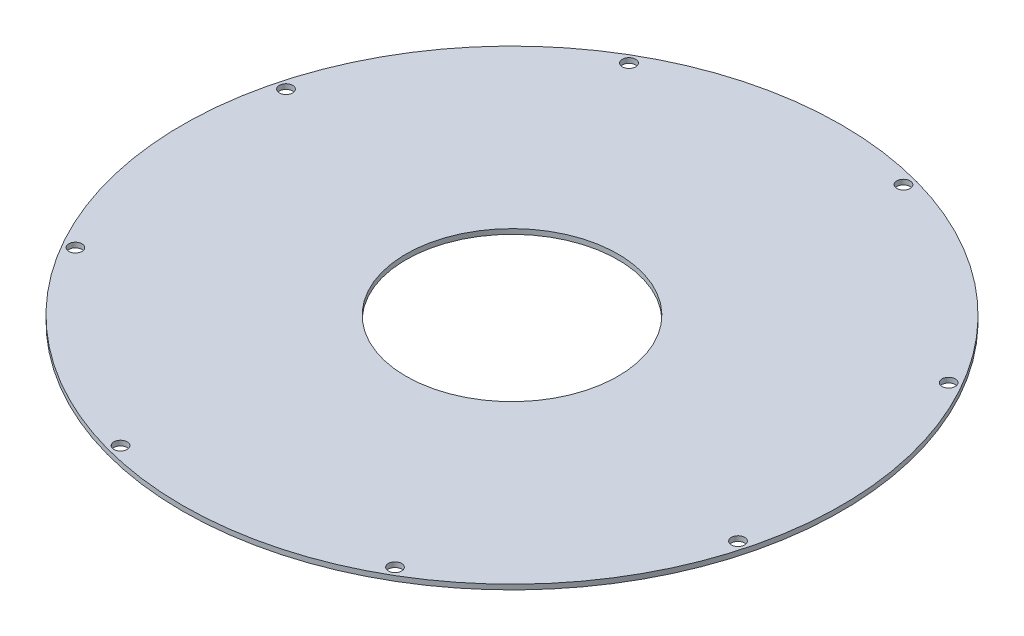
from build123d import *

# Parameters (mm, degrees)
SKETCH1_R                     = 99.5
SKETCH1_R_2                   = 32
BASE_DEPTH                    = 0.75
SKETCH2_R                     = 2
STRUCTURAL_HOLE_DEPTH         = 141.722244155
STRUCTURAL_HOLE_PATTERN_COUNT = 8


with BuildPart() as part:
    # Sketch1 → Base (new, symmetric)
    with BuildSketch(Plane(origin=(0, 0, 0), x_dir=(1, 0, 0), z_dir=(0, 1, 0))):
        Circle(SKETCH1_R)
        Circle(SKETCH1_R_2, mode=Mode.SUBTRACT)
    extrude(amount=BASE_DEPTH, both=True)

    # Sketch2 → Structural Hole (cut, through all)
    with BuildSketch(Plane(origin=(0, 0.75, 0), x_dir=(1, 0, 0), z_dir=(0, 1, 0))):
        with Locations((24.976037852, 93.211842237)):
            Circle(SKETCH2_R)
    structural_hole = extrude(amount=-STRUCTURAL_HOLE_DEPTH, mode=Mode.SUBTRACT)

    # Structural Hole Pattern: Structural Hole ×8 about axis
    structural_hole_pattern_axis = Axis((0, 0.75, 0), (0, -1, 0))
    for i in range(1, STRUCTURAL_HOLE_PATTERN_COUNT):
        add(structural_hole.rotate(structural_hole_pattern_axis, i * 360 / STRUCTURAL_HOLE_PATTERN_COUNT), mode=Mode.SUBTRACT)


solid = part.part
